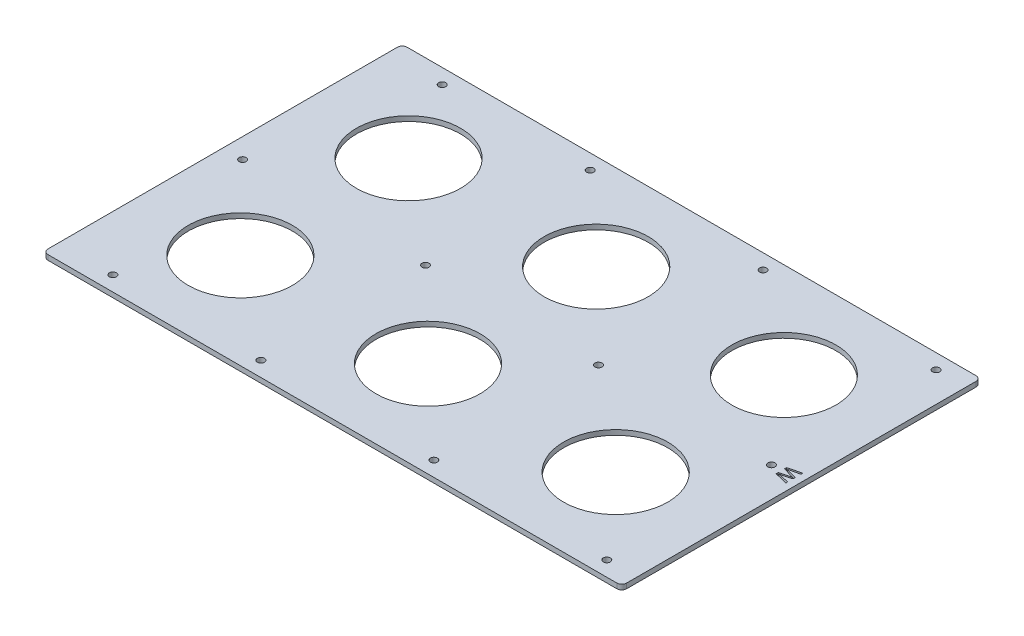
from build123d import *

# Parameters (mm, degrees)
SKETCH1_R           = 33.147
SKETCH1_R_2         = 2.2479
BOSS_EXTRUDE1_DEPTH = 3.175
CUT_EXTRUDE1_DEPTH  = 1.524


with BuildPart() as part:
    # Sketch1 → Boss-Extrude1 (new body)
    with BuildSketch(Plane(origin=(0, 0, 0), x_dir=(1, 0, 0), z_dir=(0, 1, 0))):
        with BuildLine():
            Line((-180.975, 114.3), (180.975, 114.3))
            ThreePointArc((180.975, 114.3), (183.22006403, 113.37006403), (184.15, 111.125))
            Line((184.15, 111.125), (184.15, -111.125))
            ThreePointArc((184.15, -111.125), (183.22006403, -113.37006403), (180.975, -114.3))
            Line((180.975, -114.3), (-180.975, -114.3))
            ThreePointArc((-180.975, -114.3), (-183.22006403, -113.37006403), (-184.15, -111.125))
            Line((-184.15, -111.125), (-184.15, 111.125))
            ThreePointArc((-184.15, 111.125), (-183.22006403, 113.37006403), (-180.975, 114.3))
        make_face()
        with Locations((119.508581684, -53.5178)):
            Circle(SKETCH1_R, mode=Mode.SUBTRACT)
        with Locations((165.1, 0)):
            Circle(SKETCH1_R_2, mode=Mode.SUBTRACT)
        with Locations((-171.45, 0)):
            Circle(SKETCH1_R_2, mode=Mode.SUBTRACT)
        with Locations((-55.033333333, 0)):
            Circle(SKETCH1_R_2, mode=Mode.SUBTRACT)
        with Locations((55.033333333, 0)):
            Circle(SKETCH1_R_2, mode=Mode.SUBTRACT)
        with Locations((119.508581684, 53.5178)):
            Circle(SKETCH1_R, mode=Mode.SUBTRACT)
        with Locations((0.064290842, 53.5178)):
            Circle(SKETCH1_R, mode=Mode.SUBTRACT)
        with Locations((0.064290842, -53.5178)):
            Circle(SKETCH1_R, mode=Mode.SUBTRACT)
        with Locations((-119.38, 53.5178)):
            Circle(SKETCH1_R, mode=Mode.SUBTRACT)
        with Locations((-119.38, -53.5178)):
            Circle(SKETCH1_R, mode=Mode.SUBTRACT)
        with Locations((-149.225, -104.775)):
            Circle(SKETCH1_R_2, mode=Mode.SUBTRACT)
        with Locations((-55.033333333, -104.775)):
            Circle(SKETCH1_R_2, mode=Mode.SUBTRACT)
        with Locations((55.033333333, -104.775)):
            Circle(SKETCH1_R_2, mode=Mode.SUBTRACT)
        with Locations((165.1, -104.775)):
            Circle(SKETCH1_R_2, mode=Mode.SUBTRACT)
        with Locations((-149.225, 104.775)):
            Circle(SKETCH1_R_2, mode=Mode.SUBTRACT)
        with Locations((-55.033333333, 104.775)):
            Circle(SKETCH1_R_2, mode=Mode.SUBTRACT)
        with Locations((55.033333333, 104.775)):
            Circle(SKETCH1_R_2, mode=Mode.SUBTRACT)
        with Locations((165.1, 104.775)):
            Circle(SKETCH1_R_2, mode=Mode.SUBTRACT)
    extrude(amount=BOSS_EXTRUDE1_DEPTH)

    # Sketch2 → Cut-Extrude1 (cut)
    with BuildSketch(Plane(origin=(0, 3.175, 0), x_dir=(1, 0, 0), z_dir=(0, 1, 0))):
        with BuildLine():
            Line((171.45, 3.35692423), (179.668619792, 5.426396401))
            Line((179.668619792, 5.426396401), (179.668619792, 4.229494039))
            Line((179.668619792, 4.229494039), (174.263626046, 3.009542664))
            add(Edge.make_bspline(
                [(174.263626046, 3.009542664), (173.984868687, 2.946317196), (173.430199851, 2.82051174), (172.875222779, 2.696073098), (172.599157976, 2.63417301)],
                knots=[0, 0, 0, 0, 1.00513078, 2, 2, 2, 2], degree=3))
            add(Edge.make_bspline(
                [(172.599157976, 2.63417301), (172.698424046, 2.604865261), (172.8858203, 2.549537571), (173.151472547, 2.474745256), (173.383326442, 2.406813793), (173.582462852, 2.348939672), (173.749161553, 2.302079221), (173.881374159, 2.261620439), (173.981689825, 2.234044239), (174.036994185, 2.217702533), (174.059477638, 2.21105897)],
                knots=[0, 0, 0, 0, 1.633809233, 3.084334118, 4.356383392, 5.447555203, 6.357852567, 7.089694452, 7.629924063, 8, 8, 8, 8], degree=3))
            Line((174.059477638, 2.21105897), (179.668619792, 0.587749853))
            Line((179.668619792, 0.587749853), (179.668619792, -0.806715484))
            Line((179.668619792, -0.806715484), (175.551078105, -1.980568832))
            add(Edge.make_bspline(
                [(175.551078105, -1.980568832), (175.296712529, -2.045349191), (174.795158662, -2.173082039), (174.048075598, -2.342795744), (173.319116921, -2.49943607), (172.836990124, -2.589663839), (172.599157976, -2.63417301)],
                knots=[0, 0, 0, 0, 1.04154457, 2.053700482, 3.039894486, 4, 4, 4, 4], degree=3))
            add(Edge.make_bspline(
                [(172.599157976, -2.63417301), (172.720980898, -2.661645998), (172.977226876, -2.719433502), (173.381816931, -2.809933441), (173.825093055, -2.910447181), (174.134101714, -2.979956246), (174.294906851, -3.016128097)],
                knots=[0, 0, 0, 0, 0.862132589, 1.813435466, 2.862132822, 4, 4, 4, 4], degree=3))
            Line((174.294906851, -3.016128097), (179.668619792, -4.229494039))
            Line((179.668619792, -4.229494039), (179.668619792, -5.426396401))
            Line((179.668619792, -5.426396401), (171.45, -3.355277872))
            Line((171.45, -3.355277872), (171.45, -2.080996678))
            Line((171.45, -2.080996678), (177.730856271, -0.363845147))
            add(Edge.make_bspline(
                [(177.730856271, -0.363845147), (177.792257478, -0.346602472), (177.908896909, -0.31384781), (178.075345329, -0.27091412), (178.221729866, -0.228338076), (178.349942301, -0.194473031), (178.458690649, -0.165165669), (178.547656515, -0.139212748), (178.618581103, -0.122520526), (178.658892529, -0.110449487), (178.675865838, -0.10536692)],
                knots=[0, 0, 0, 0, 1.562239628, 2.967673567, 4.210417925, 5.296319877, 6.215971374, 6.969386481, 7.566055473, 8, 8, 8, 8], degree=3))
            add(Edge.make_bspline(
                [(178.675865838, -0.10536692), (178.568229296, -0.074892118), (178.364849129, -0.017309719), (178.078532422, 0.067967153), (177.826773257, 0.139523409), (177.671018148, 0.184870245), (177.599147621, 0.205794766)],
                knots=[0, 0, 0, 0, 1.197730334, 2.263121701, 3.198547257, 4, 4, 4, 4], degree=3))
            Line((177.599147621, 0.205794766), (171.45, 1.985507906))
            Line((171.45, 1.985507906), (171.45, 3.35692423))
        make_face()
    extrude(amount=-CUT_EXTRUDE1_DEPTH, mode=Mode.SUBTRACT)


solid = part.part
